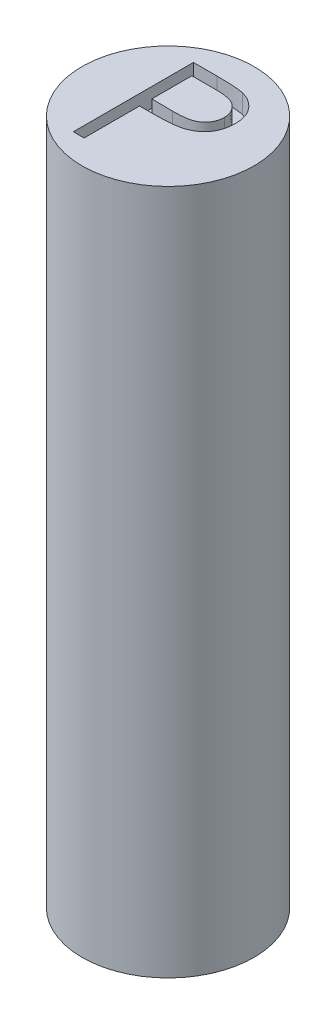
from build123d import *

# Parameters (mm, degrees)
SKETCH1_R           = 9.1
BOSS_EXTRUDE1_DEPTH = 72.5
CUT_EXTRUDE2_DEPTH  = 2


with BuildPart() as part:
    # Sketch1 → Boss-Extrude1 (new body)
    with BuildSketch(Plane(origin=(0, 0, 0), x_dir=(1, 0, 0), z_dir=(0, 1, 0))):
        Circle(SKETCH1_R)
    extrude(amount=BOSS_EXTRUDE1_DEPTH)

    # Sketch3 → Cut-Extrude2 (cut)
    with BuildSketch(Plane(origin=(0, 72.5, 0), x_dir=(1, 0, 0), z_dir=(0, 1, 0))):
        with BuildLine():
            Line((-3.582051282, 6.265328291), (-1.09140625, 6.265328291))
            add(Edge.make_bspline(
                [(-1.09140625, 6.265328291), (-0.920098105, 6.265139982), (-0.591864091, 6.264779173), (-0.121183746, 6.253839953), (0.30629728, 6.239228813), (0.689657234, 6.218974515), (1.030075647, 6.195038316), (1.326012134, 6.16146663), (1.57979281, 6.126413557), (1.731853355, 6.090775882), (1.801201923, 6.074523003)],
                knots=[0, 0, 0, 0, 1.415646017, 2.712440637, 3.8905458, 4.950247383, 5.884950622, 6.709939814, 7.411656543, 8, 8, 8, 8], degree=3))
            add(Edge.make_bspline(
                [(1.801201923, 6.074523003), (1.888989889, 6.050494785), (2.062497206, 6.003004544), (2.312509562, 5.907886176), (2.550376373, 5.795102319), (2.776913742, 5.666564023), (2.989337872, 5.516756405), (3.190818078, 5.351752134), (3.379576292, 5.167741586), (3.554551057, 4.966788615), (3.715241608, 4.752266711), (3.853597886, 4.520973477), (3.969448109, 4.276802176), (4.068810266, 4.019922646), (4.140323801, 3.748177758), (4.194196837, 3.463455687), (4.228391143, 3.165786954), (4.231666153, 2.962369721), (4.233333333, 2.858817875)],
                knots=[0, 0, 0, 0, 0.999701418, 1.975846123, 2.934577507, 3.890451536, 4.834027766, 5.787354733, 6.749476667, 7.726910423, 8.712836071, 9.690891519, 10.682875813, 11.679750201, 12.712814741, 13.765529915, 14.8625177, 16, 16, 16, 16], degree=3))
            add(Edge.make_bspline(
                [(4.233333333, 2.858817875), (4.231804164, 2.754395656), (4.22881224, 2.550086532), (4.192902862, 2.251190987), (4.144533309, 1.965555685), (4.070158291, 1.693813965), (3.972746848, 1.437579598), (3.858475685, 1.192936842), (3.720649732, 0.964047747), (3.56228135, 0.750081349), (3.386108422, 0.55083681), (3.192876332, 0.367757984), (2.983365185, 0.201916527), (2.758240819, 0.052940652), (2.51530851, -0.075714991), (2.258252696, -0.19094864), (1.984839053, -0.287726489), (1.795636217, -0.338635569), (1.699439103, -0.364519465)],
                knots=[0, 0, 0, 0, 1.121902311, 2.195077645, 3.232258892, 4.234102512, 5.217864754, 6.176164875, 7.132989551, 8.084763148, 9.034132444, 9.988522005, 10.94243251, 11.903244335, 12.886203696, 13.894208494, 14.929344452, 16, 16, 16, 16], degree=3))
            add(Edge.make_bspline(
                [(1.699439103, -0.364519465), (1.619874205, -0.381439425), (1.445503106, -0.418520501), (1.158328085, -0.459916902), (0.823971971, -0.495250481), (0.442891126, -0.52174318), (0.015427614, -0.544423089), (-0.458649805, -0.562450172), (-0.980271743, -0.572355642), (-1.344113114, -0.572866519), (-1.534074519, -0.573133247)],
                knots=[0, 0, 0, 0, 0.601384939, 1.31797006, 2.144135048, 3.087295005, 4.142315834, 5.309527816, 6.595305764, 8, 8, 8, 8], degree=3))
            Line((-1.534074519, -0.573133247), (-2.442307692, -0.573133247))
            Line((-2.442307692, -0.573133247), (-2.442307692, -6.434671709))
            Line((-2.442307692, -6.434671709), (-3.582051282, -6.434671709))
            Line((-3.582051282, -6.434671709), (-3.582051282, 6.265328291))
        make_face()
        with BuildLine():
            Line((-2.442307692, 4.962764189), (-2.442307692, 0.729430855))
            Line((-2.442307692, 0.729430855), (-0.218790064, 0.70144608))
            add(Edge.make_bspline(
                [(-0.218790064, 0.70144608), (-0.110223476, 0.701389969), (0.099362084, 0.701281648), (0.402116379, 0.715742316), (0.683001508, 0.732435678), (0.941154681, 0.756877457), (1.176692272, 0.79142602), (1.39000702, 0.826302898), (1.579444875, 0.876759499), (1.801147692, 0.944697493), (2.048192982, 1.06056727), (2.316952372, 1.228751156), (2.544719928, 1.443129726), (2.741817748, 1.684167857), (2.898230505, 1.952316127), (3.012733677, 2.239223411), (3.080011591, 2.541947322), (3.089032922, 2.749095712), (3.093589744, 2.853729734)],
                knots=[0, 0, 0, 0, 1.160613943, 2.240541288, 3.23993089, 4.169200891, 5.011653406, 5.7853311, 6.478053781, 7.106038997, 8.262395093, 9.384106736, 10.481365981, 11.59014053, 12.70357646, 13.786202915, 14.881775077, 16, 16, 16, 16], degree=3))
            add(Edge.make_bspline(
                [(3.093589744, 2.853729734), (3.089008141, 2.955832339), (3.079900481, 3.158799683), (3.012206349, 3.456265472), (2.898453124, 3.740149313), (2.740767767, 4.004937366), (2.54939281, 4.245108169), (2.326963765, 4.453740601), (2.074004216, 4.621459351), (1.838697778, 4.729711545), (1.62968776, 4.795806973), (1.44814322, 4.842052537), (1.243162773, 4.878975451), (1.014679687, 4.908873075), (0.76446489, 4.934467063), (0.490368719, 4.951833323), (0.193429499, 4.961998607), (-0.012711715, 4.962502816), (-0.119571314, 4.962764189)],
                knots=[0, 0, 0, 0, 1.120700087, 2.227813068, 3.331159281, 4.466773991, 5.599788987, 6.693661531, 7.80175334, 8.91857717, 9.525282508, 10.207424825, 10.974604443, 11.810962634, 12.737642355, 13.736264703, 14.826523623, 16, 16, 16, 16], degree=3))
            Line((-0.119571314, 4.962764189), (-2.442307692, 4.962764189))
        make_face(mode=Mode.SUBTRACT)
    extrude(amount=-CUT_EXTRUDE2_DEPTH, mode=Mode.SUBTRACT)


solid = part.part
